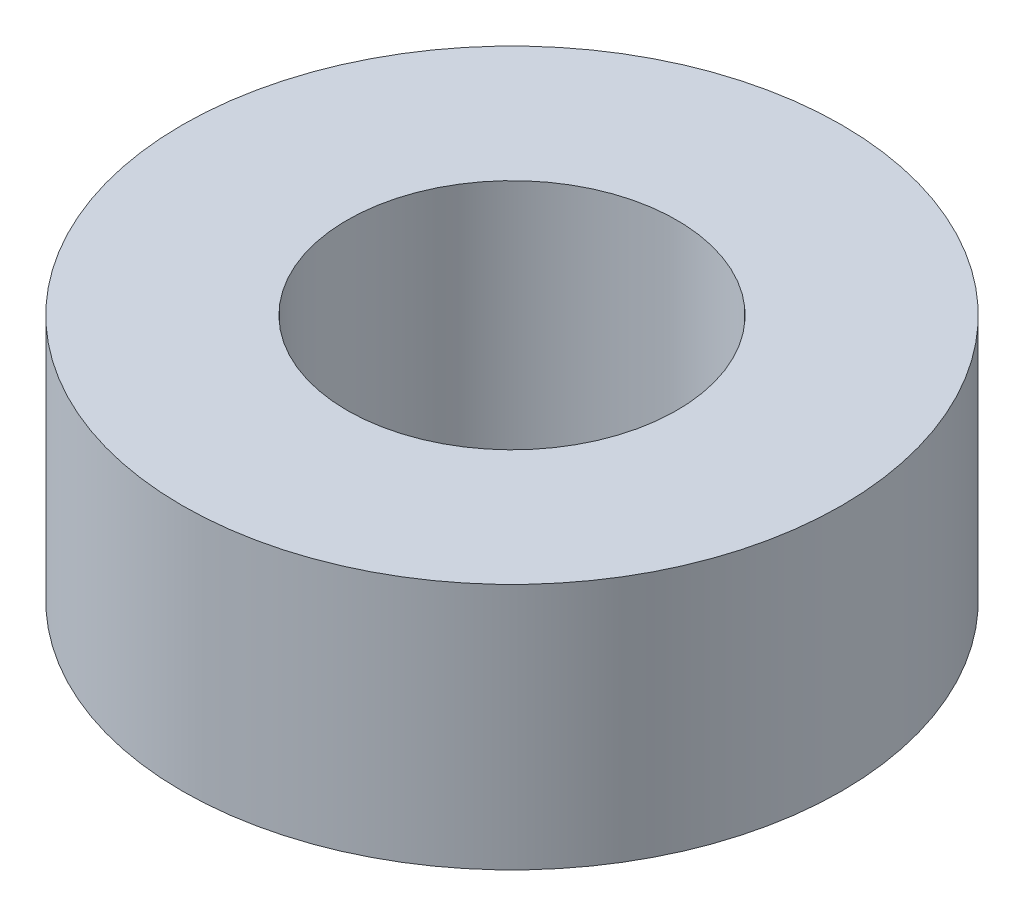
from build123d import *

# Parameters (mm, degrees)
SKETCH2_R           = 4
SKETCH2_R_2         = 2
BOSS_EXTRUDE1_DEPTH = 3


with BuildPart() as part:
    # Sketch2 → Boss-Extrude1 (new body)
    with BuildSketch(Plane(origin=(0, 0, 0), x_dir=(1, 0, 0), z_dir=(0, 1, 0))):
        Circle(SKETCH2_R)
        Circle(SKETCH2_R_2, mode=Mode.SUBTRACT)
    extrude(amount=BOSS_EXTRUDE1_DEPTH)


solid = part.part
